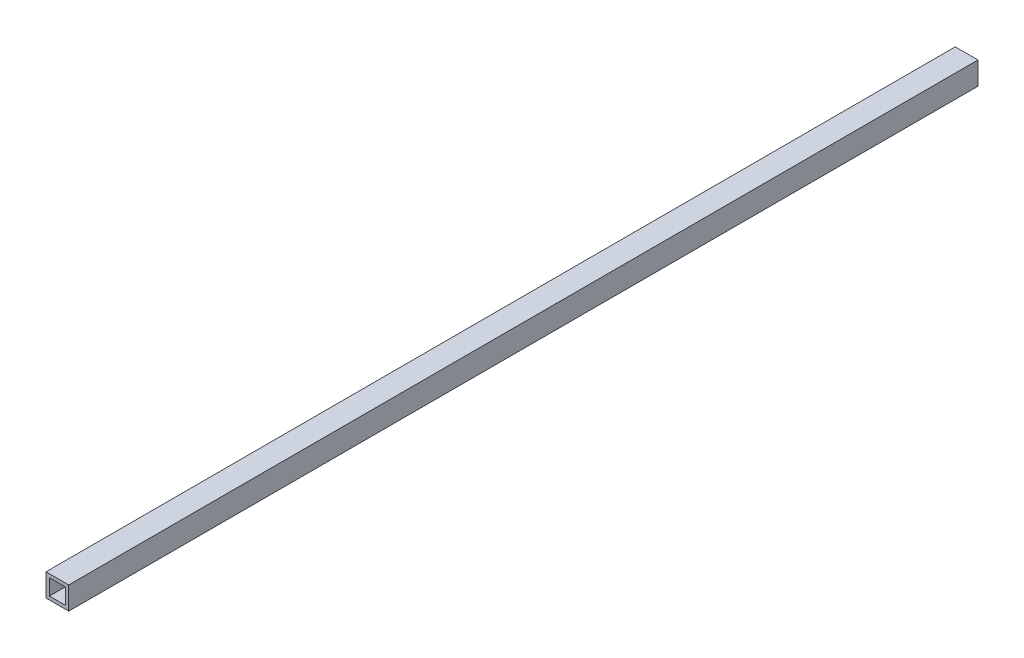
from build123d import *

# Parameters (mm, degrees)
SKETCH_1_W          = 20
SKETCH_1_H          = 20
EXTRUDE_1_DEPTH     = 800
SKETCH_2_W          = 14
SKETCH_2_H          = 14
CUT_EXTRUDE_1_DEPTH = 801.146807195


with BuildPart() as part:
    # 草图1 → 凸台-拉伸1 (new body)
    with BuildSketch(Plane.XY):
        with Locations((0.666666667, 1.006147649)):
            Rectangle(SKETCH_1_W, SKETCH_1_H)
    extrude(amount=EXTRUDE_1_DEPTH)

    # 草图2 → 切除-拉伸1 (cut, through all)
    with BuildSketch(Plane(origin=(0, 0, 0), x_dir=(-1, 0, 0), z_dir=(0, 0, -1))):
        with Locations((-0.666666667, 1.006147649)):
            Rectangle(SKETCH_2_W, SKETCH_2_H)
    extrude(amount=-CUT_EXTRUDE_1_DEPTH, mode=Mode.SUBTRACT)


solid = part.part
